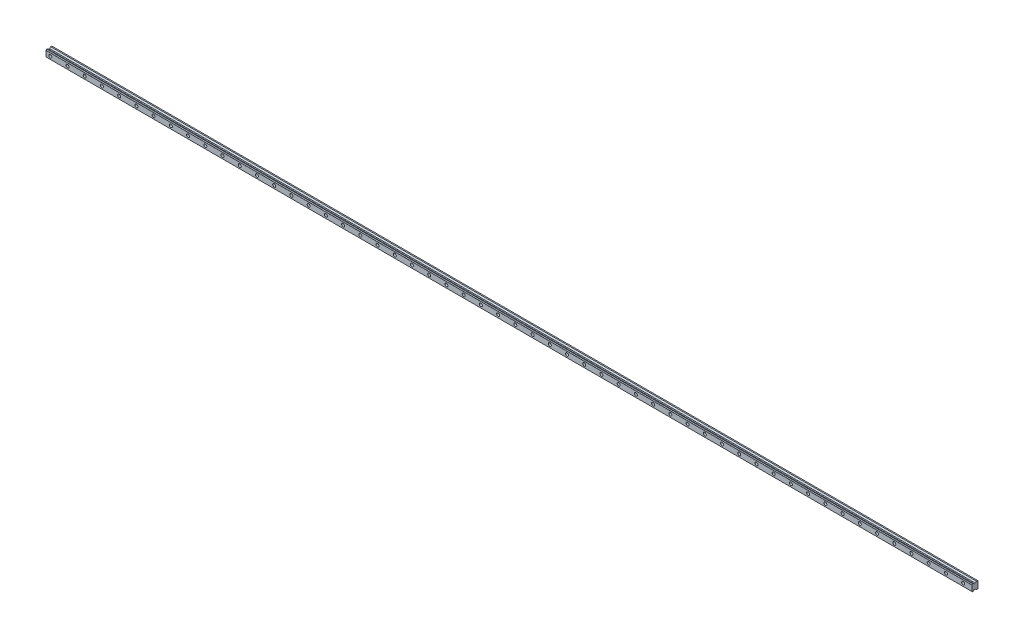
from build123d import *

# Parameters (mm, degrees)
SKETCH1_W                               = 200
SKETCH1_H                               = 34
BOSS_EXTRUDE1_DEPTH                     = 29
SKETCH2_W                               = 0.5
SKETCH2_H                               = 4.5
CUT_EXTRUDE1_DEPTH                      = 203.805325376
CUT_EXTRUDE2_DEPTH                      = 203.805325376
CUT_EXTRUDE3_DEPTH                      = 203.805325376
SKETCH5_W                               = 0.500000016
SKETCH5_H                               = 4.5
CUT_EXTRUDE4_DEPTH                      = 203.805325376
DRAFT1_ANGLE                            = 45.000110184
DRAFT2_ANGLE                            = 45.000110184
DRAFT3_ANGLE                            = 45
DRAFT4_ANGLE                            = 45
M6_CLEARANCE_HOLE1_D                    = 6.48
CBORE_FOR_M8_HEX_HEAD_BOLT1_D           = 9
CBORE_FOR_M8_HEX_HEAD_BOLT1_CBORE_D     = 14
CBORE_FOR_M8_HEX_HEAD_BOLT1_CBORE_DEPTH = 12.000000016
CHAMFER1_SIZE                           = 0.475792536
CHAMFER1_SIZE_2                         = 0.457737319
CHAMFER1_SIZE_3                         = 0.457476669
CHAMFER2_SIZE                           = 1.5
BOSS_EXTRUDE4_START                     = 4100
BOSS_EXTRUDE4_DEPTH                     = 4100
LPATTERN1_COUNT                         = 52
LPATTERN1_PITCH                         = 80


with BuildPart() as part:
    # Sketch1 → Boss-Extrude1 (new body)
    with BuildSketch(Plane(origin=(0, 0, 0), x_dir=(-1, 0, 0), z_dir=(0, 0, -1))):
        with Locations((-80, 2.9e-08)):
            Rectangle(SKETCH1_W, SKETCH1_H)
    extrude(amount=-BOSS_EXTRUDE1_DEPTH)

    # Sketch2 → Cut-Extrude1 (cut, through all)
    with BuildSketch(Plane(origin=(180, 0, 0), x_dir=(0, 0, -1), z_dir=(1, 0, 0))):
        with Locations((-0.25, -5.999999987)):
            Rectangle(SKETCH2_W, SKETCH2_H)
    extrude(amount=-CUT_EXTRUDE1_DEPTH, mode=Mode.SUBTRACT)

    # Sketch3 → Cut-Extrude2 (cut, through all)
    with BuildSketch(Plane(origin=(180, 0, 0), x_dir=(0, 0, -1), z_dir=(1, 0, 0))):
        with BuildLine():
            Line((-22.368719002, -16.999999971), (-12.200000016, -16.999999971))
            Line((-12.200000016, -16.999999971), (-12.200000016, -11.799999971))
            Line((-12.200000016, -11.799999971), (-17.680000016, -11.799999971))
            Line((-17.680000016, -11.799999971), (-19.532492595, -13.65249255))
            ThreePointArc((-19.532492595, -13.65249255), (-21.603442823, -14.773120195), (-22.368719002, -16.999999971))
        make_face()
    extrude(amount=-CUT_EXTRUDE2_DEPTH, mode=Mode.SUBTRACT)

    # Sketch4 → Cut-Extrude3 (cut, through all)
    with BuildSketch(Plane(origin=(180, 0, 0), x_dir=(0, 0, -1), z_dir=(1, 0, 0))):
        with BuildLine():
            Line((-6.999980016, 17.000000029), (-22.368719002, 17.000000029))
            ThreePointArc((-22.368719002, 17.000000029), (-21.603442823, 14.773120253), (-19.532492595, 13.652492608))
            Line((-19.532492595, 13.652492608), (-17.680000016, 11.800000029))
            Line((-17.680000016, 11.800000029), (-6.999980016, 11.800000029))
            Line((-6.999980016, 11.800000029), (-6.999980016, 17.000000029))
        make_face()
    extrude(amount=-CUT_EXTRUDE3_DEPTH, mode=Mode.SUBTRACT)

    # Sketch5 → Cut-Extrude4 (cut, through all)
    with BuildSketch(Plane(origin=(180, 0, 0), x_dir=(0, 0, -1), z_dir=(1, 0, 0))):
        with Locations((-0.250000008, 6.000000061)):
            Rectangle(SKETCH5_W, SKETCH5_H)
    extrude(amount=-CUT_EXTRUDE4_DEPTH, mode=Mode.SUBTRACT)

    # Draft1
    draft1_faces = [part.faces().sort_by_distance(p)[0] for p in [
        (80, 14.400000029, 6.999980016),
    ]]
    draft(draft1_faces, Plane(origin=(-20, 17.000000029, 29), x_dir=(0, 0, 1), z_dir=(0, 1, 0)), DRAFT1_ANGLE)

    # Draft2
    draft2_faces = [part.faces().sort_by_distance(p)[0] for p in [
        (80, -14.399999971, 12.200000016),
    ]]
    draft(draft2_faces, Plane(origin=(-20, -11.799999971, 12.200000016), x_dir=(0, 0, -1), z_dir=(0, -1, 0)), DRAFT2_ANGLE)

    # Draft3
    draft3_faces = [part.faces().sort_by_distance(p)[0] for p in [
        (80, 8.250000061, 0.250000008),
        (80, 3.750000061, 0.250000008),
    ]]
    draft(draft3_faces, Plane(origin=(-20, 8.250000061, 0.500000016), x_dir=(-1, 0, 0), z_dir=(0, 0, -1)), DRAFT3_ANGLE)

    # Draft4
    draft4_faces = [part.faces().sort_by_distance(p)[0] for p in [
        (80, -8.249999987, 0.25),
        (80, -3.749999987, 0.25),
    ]]
    draft(draft4_faces, Plane(origin=(-20, -3.749999987, 0.5), x_dir=(-1, 0, 0), z_dir=(0, 0, -1)), DRAFT4_ANGLE)

    # M6 Clearance Hole1 (through all)
    with Locations(Plane.ZY.offset(20)):
        with Locations((28.869573609, -16.867573564), (28.869573609, 16.867573622)):
            Hole(M6_CLEARANCE_HOLE1_D / 2)

    # CBORE for M8 Hex Head Bolt1 (through all)
    with Locations(Plane.XY.offset(29)):
        with Locations((80, 0), (160, 0), (0, 0)):
            cbore_for_m8_hex_head_bolt1 = CounterBoreHole(CBORE_FOR_M8_HEX_HEAD_BOLT1_D / 2, CBORE_FOR_M8_HEX_HEAD_BOLT1_CBORE_D / 2, CBORE_FOR_M8_HEX_HEAD_BOLT1_CBORE_DEPTH)

    # Chamfer1
    # the kernel refuses this chamfer: 0.475792536, 0.457737319, 0.457476669 mm, written as the material it takes off along each edge
    with BuildSketch(Plane(origin=(-21.269092564, -16.999999971, 25.632281029), x_dir=(0, 0.9993750884176777, 0.03534731461028823), z_dir=(1, 0, 0))) as chamfer1_piece_1:
        with BuildLine():
            Line((0.493546503, 0), (-CHAMFER1_SIZE * 0.0353473146329, -CHAMFER1_SIZE * 0.999375089057))
            Line((-CHAMFER1_SIZE * 0.0353473146329, -CHAMFER1_SIZE * 0.999375089057), (0, 0))
            ThreePointArc((0, 0), (0.253769926, -0.009403805), (0.493546503, 0))
        make_face()
    extrude(amount=202.538185128, mode=Mode.SUBTRACT)
    with BuildSketch(Plane(origin=(-21.334170871, -13.630199789, 29), x_dir=(0, 1, 0), z_dir=(1, 0, 0))) as chamfer1_piece_2:
        with BuildLine():
            Line((CHAMFER1_SIZE_2, 0), (-0.020713147, -0.518620162))
            ThreePointArc((-0.020713147, -0.518620162), (-0.000253617, -0.267002697), (0, 0))
            Line((0, 0), (CHAMFER1_SIZE_2, 0))
        make_face()
    extrude(amount=202.668341741, mode=Mode.SUBTRACT)
    with BuildSketch(Plane(origin=(181.334170871, -16.999999971, 22.368719002), x_dir=(0, 0, 1), z_dir=(-1, 0, 0))) as chamfer1_piece_3:
        with BuildLine():
            Line((CHAMFER1_SIZE_3, 0), (-0.02039274, 0.51863286))
            ThreePointArc((-0.02039274, 0.51863286), (-8.8664e-05, 0.267002802), (0, 0))
            Line((0, 0), (CHAMFER1_SIZE_3, 0))
        make_face()
    extrude(amount=202.668341741, mode=Mode.SUBTRACT)
    with BuildSketch(Plane(origin=(181.269092564, 17.000000029, 22.368719002), x_dir=(0, -0.9993750884177729, -0.03534731460759742), z_dir=(-1, 0, 0))) as chamfer1_piece_4:
        with BuildLine():
            Line((0.493546503, 0), (-CHAMFER1_SIZE * 0.0353473146304, CHAMFER1_SIZE * 0.999375089057))
            Line((-CHAMFER1_SIZE * 0.0353473146304, CHAMFER1_SIZE * 0.999375089057), (0, 0))
            ThreePointArc((0, 0), (0.253769926, 0.009403805), (0.493546503, 0))
        make_face()
    extrude(amount=202.538185128, mode=Mode.SUBTRACT)
    with BuildSketch(Plane(origin=(-21.334170871, 13.630199847, 29), x_dir=(0, 0.039907137894286876, -0.9992033928810922), z_dir=(1, 0, 0))) as chamfer1_piece_5:
        with BuildLine():
            Line((0.519033628, 0), (-CHAMFER1_SIZE_2 * 0.0399071378656, -CHAMFER1_SIZE_2 * 0.999203392163))
            Line((-CHAMFER1_SIZE_2 * 0.0399071378656, -CHAMFER1_SIZE_2 * 0.999203392163), (0, 0))
            ThreePointArc((0, 0), (0.266800122, -0.010401898), (0.519033628, 0))
        make_face()
    extrude(amount=202.668341741, mode=Mode.SUBTRACT)
    with BuildSketch(Plane(origin=(-21.269092564, 17.000000029, 25.632281029), x_dir=(0, 0, -1), z_dir=(1, 0, 0))) as chamfer1_piece_6:
        with BuildLine():
            Line((CHAMFER1_SIZE, 0), (-0.017445543, -0.49323808))
            ThreePointArc((-0.017445543, -0.49323808), (0.000427843, -0.253943742), (0, 0))
            Line((0, 0), (CHAMFER1_SIZE, 0))
        make_face()
    extrude(amount=202.538185128, mode=Mode.SUBTRACT)

    # Chamfer2
    chamfer2_edges = [part.edges().sort_by_distance(p)[0] for p in [
        (80, -16.999999971, 0),
        (80, 17.000000029, 0),
    ]]
    chamfer(chamfer2_edges, length=CHAMFER2_SIZE)

    # Sketch10 → Boss-Extrude4 (add)
    with BuildSketch(Plane(origin=(180, 0, 0), x_dir=(0, 0, -1), z_dir=(1, 0, 0)).offset(BOSS_EXTRUDE4_START)):
        with BuildLine():
            Line((0, 8.750000076), (0, 15.500000029))
            Line((0, 15.500000029), (-1.5, 17.000000029))
            Line((-1.5, 17.000000029), (-6.999980016, 17.000000029))
            Line((-6.999980016, 17.000000029), (-12.200000016, 11.800000029))
            Line((-12.200000016, 11.800000029), (-17.680000016, 11.800000029))
            Line((-17.680000016, 11.800000029), (-19.532492595, 13.652492608))
            ThreePointArc((-19.532492595, 13.652492608), (-21.436739088, 14.590923997), (-22.351273459, 16.506761949))
            Line((-22.351273459, 16.506761949), (-22.844511539, 17.000000029))
            Line((-22.844511539, 17.000000029), (-25.156488493, 17.000000029))
            Line((-25.156488493, 17.000000029), (-25.649726573, 16.506761949))
            ThreePointArc((-25.649726573, 16.506761949), (-26.568822008, 14.586314744), (-28.481379838, 13.650912994))
            Line((-28.481379838, 13.650912994), (-29, 13.172462529))
            Line((-29, 13.172462529), (-29, -13.172462471))
            Line((-29, -13.172462471), (-28.481379838, -13.650912936))
            ThreePointArc((-28.481379838, -13.650912936), (-26.568822008, -14.586314686), (-25.649726573, -16.506761891))
            Line((-25.649726573, -16.506761891), (-25.156488493, -16.999999971))
            Line((-25.156488493, -16.999999971), (-22.826195671, -16.999999971))
            Line((-22.826195671, -16.999999971), (-22.348326262, -16.481367111))
            ThreePointArc((-22.348326262, -16.481367111), (-21.427739192, -14.58184662), (-19.532492595, -13.65249255))
            Line((-19.532492595, -13.65249255), (-17.680000016, -11.799999971))
            Line((-17.680000016, -11.799999971), (-12.200000016, -11.799999971))
            Line((-12.200000016, -11.799999971), (-6.999980016, -16.999999971))
            Line((-6.999980016, -16.999999971), (-1.5, -16.999999971))
            Line((-1.5, -16.999999971), (0, -15.499999971))
            Line((0, -15.499999971), (0, -8.749999987))
            Line((0, -8.749999987), (-0.5, -8.249999987))
            Line((-0.5, -8.249999987), (-0.5, -3.749999987))
            Line((-0.5, -3.749999987), (0, -3.249999987))
            Line((0, -3.249999987), (0, 3.250000045))
            Line((0, 3.250000045), (-0.500000016, 3.750000061))
            Line((-0.500000016, 3.750000061), (-0.500000016, 8.250000061))
            Line((-0.500000016, 8.250000061), (0, 8.750000076))
        make_face()
    extrude(amount=-BOSS_EXTRUDE4_DEPTH)

    # LPattern1: CBORE for M8 Hex Head Bolt1 ×52
    with Locations(*[(i * LPATTERN1_PITCH, 0, 0) for i in range(1, LPATTERN1_COUNT)]):
        add(cbore_for_m8_hex_head_bolt1, mode=Mode.SUBTRACT)


solid = part.part
